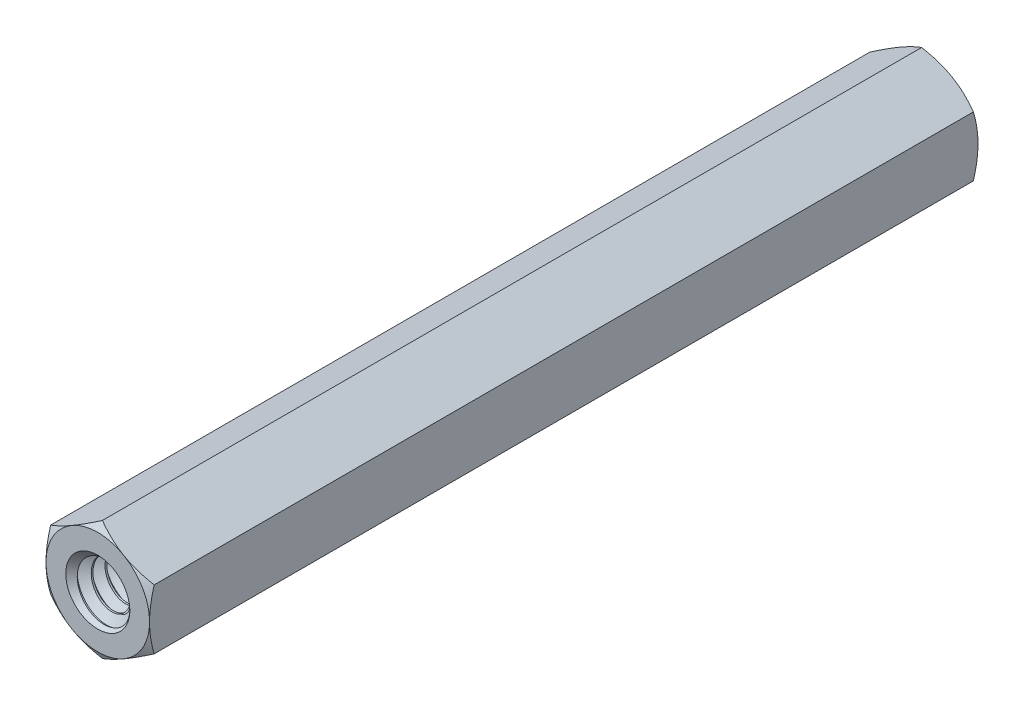
from build123d import *

# Parameters (mm, degrees)
EXTRUDE1_DEPTH          = 19.05
EXTRUDE1_DEPTH_BACK     = 19.05
SKETCH1_R               = 1.4224
SWEEP1_PITCH            = 0.635
EXTRUDE2_DEPTH          = 39.905584076
SKETCH8_OUTSIDE_W       = 152.882
SKETCH8_OUTSIDE_H       = 153.62
SKETCH8_OUTSIDE_R       = 2.38125
EXTRUDE4_DEPTH          = 39.905584076
EXTRUDE4_DRAFT          = -60
MIRROR1_COPY_1_SKETCH_W = 152.882
MIRROR1_COPY_1_SKETCH_H = 153.62
MIRROR1_COPY_1_SKETCH_R = 2.38125
MIRROR1_COPY_1_DEPTH    = 39.905584076
MIRROR1_COPY_1_DRAFT    = -60
SKETCH9_W               = 25.4
SKETCH9_H               = 1.4732


with BuildPart() as part:
    # Sketch1 → Extrude1 (new, two sides: drawn at the far end of the back side and taken through both)
    with BuildSketch(Plane.XY.offset(-EXTRUDE1_DEPTH_BACK)):
        Polygon((0, 2.749630657), (-2.38125, 1.374815329), (-2.38125, -1.374815329), (0, -2.749630657), (2.38125, -1.374815329), (2.38125, 1.374815329), align=None)
        with Locations(Location((0, 0, 0), (0, 0, 180))):
            Circle(SKETCH1_R, mode=Mode.SUBTRACT)
    extrude(amount=EXTRUDE1_DEPTH + EXTRUDE1_DEPTH_BACK)

    # Sweep1: the profile of Sketch12 profile screwed along a right-hand helix of 61 turns, 6 arcs to a turn; built about Z, then put on its axis
    sweep1_z = Axis((0, 0, 0), (0, 0, 1))
    sweep1_corners = [(1.4227, 0, -0.555798205), (1.4227, 0, 0.000173205), (1.009955401, 0, -0.238125), (1.009955401, 0, -0.3175)]
    with BuildLine(mode=Mode.PRIVATE) as sweep1_profile:
        Line(sweep1_corners[0], sweep1_corners[1])
        Line(sweep1_corners[1], sweep1_corners[2])
        Line(sweep1_corners[2], sweep1_corners[3])
        Line(sweep1_corners[3], sweep1_corners[0])
    sweep1_cap = Face(sweep1_profile.wire())
    sweep1_turn_angles = [0, 30, 60, 90, 120, 150, 180, 210, 240, 270, 300, 330, 360, 390, 420, 450, 480, 510, 540, 570, 600, 630, 660, 690, 720]
    sweep1_turn_weights = [1, 0.8660254037844387, 1, 0.8660254037844387, 1, 0.8660254037844387, 1, 0.8660254037844387, 1, 0.8660254037844387, 1, 0.8660254037844387, 1, 0.8660254037844387, 1, 0.8660254037844387, 1, 0.8660254037844387, 1, 0.8660254037844387, 1, 0.8660254037844387, 1, 0.8660254037844387, 1]
    sweep1_turn_rails = [Edge.make_bspline([Vector(p[0], p[1], 0).rotate(sweep1_z, sweep1_turn_angles[k]) / sweep1_turn_weights[k] + Vector(0, 0, p[2] + SWEEP1_PITCH * sweep1_turn_angles[k] / 360) for k in range(25)], [0, 0, 0, 1, 1, 2, 2, 3, 3, 4, 4, 5, 5, 6, 6, 7, 7, 8, 8, 9, 9, 10, 10, 11, 11, 12, 12, 12], 2, sweep1_turn_weights) for p in sweep1_corners]
    sweep1_turn_sides = [Face.make_surface_from_curves(sweep1_turn_rails[p[0]], sweep1_turn_rails[p[1]]) for p in [(0, 1), (1, 2), (2, 3), (3, 0)]]
    sweep1_last_angles = [21600, 21630, 21660, 21690, 21720, 21750, 21780, 21810, 21840, 21870, 21900, 21930, 21960]
    sweep1_last_weights = [1, 0.8660254037844387, 1, 0.8660254037844387, 1, 0.8660254037844387, 1, 0.8660254037844387, 1, 0.8660254037844387, 1, 0.8660254037853276, 1]
    sweep1_last_rails = [Edge.make_bspline([Vector(p[0], p[1], 0).rotate(sweep1_z, sweep1_last_angles[k]) / sweep1_last_weights[k] + Vector(0, 0, p[2] + SWEEP1_PITCH * sweep1_last_angles[k] / 360) for k in range(13)], [0, 0, 0, 1, 1, 2, 2, 3, 3, 4, 4, 5, 5, 6, 6, 6], 2, sweep1_last_weights) for p in sweep1_corners]
    sweep1_last_sides = [Face.make_surface_from_curves(sweep1_last_rails[p[0]], sweep1_last_rails[p[1]]) for p in [(0, 1), (1, 2), (2, 3), (3, 0)]]
    sweep1 = Plane(origin=(0, 0, -19.05), x_dir=(0, 1, 0), z_dir=(0, 0, 1)) * Solid(Shell([*[p.moved(Location((0, 0, 2 * SWEEP1_PITCH * i))) for i in range(30) for p in sweep1_turn_sides], *sweep1_last_sides, sweep1_cap, sweep1_cap.rotate(sweep1_z, 21960).moved(Location((0, 0, SWEEP1_PITCH * 21960 / 360)))]))
    add(sweep1)

    # Sketch6 → Extrude2 (cut, through all)
    with BuildSketch(Plane(origin=(0, 0, -19.05), x_dir=(-1, 0, 0), z_dir=(0, 0, -1))):
        Polygon((0, 2.749630657), (-2.38125, 1.374815329), (-2.38125, -1.374815329), (0, -2.749630657), (2.38125, -1.374815329), (2.38125, 1.374815329), align=None)
    extrude2 = extrude(amount=EXTRUDE2_DEPTH, mode=Mode.SUBTRACT)

    # Extrude3 cone 1 section (through the dimple's axis) → Extrude3 (revolve, cut)
    with BuildSketch(Plane(origin=(0, 0, -19.05), x_dir=(0, 1, 0), z_dir=(1, 0, 0))):
        Polygon((0, 0), (1.4732, 0), (0, 1.579813584), align=None)
    extrude3 = revolve(axis=Axis((0, 0, -19.05), (0, 0, 1)), mode=Mode.SUBTRACT)


with BuildPart() as extrude4_tool:
    # Sketch8 outside → Extrude4 (with draft: the straight prism first)
    with BuildSketch(Plane(origin=(0, 0, -19.05), x_dir=(-1, 0, 0), z_dir=(0, 0, -1))):
        Rectangle(SKETCH8_OUTSIDE_W, SKETCH8_OUTSIDE_H)
        Circle(SKETCH8_OUTSIDE_R, mode=Mode.SUBTRACT)
    extrude(amount=-EXTRUDE4_DEPTH)
    # Extrude4: the draft: its side faces are tilted about the plane it starts from
    extrude4_sides = [extrude4_tool.faces().sort_by_distance(p)[0] for p in [
        (0, -76.81, 0.902792038),
        (-76.441, 0, 0.902792038),
        (0, 76.81, 0.902792038),
        (76.441, 0, 0.902792038),
        (2.38125, 0, 0.902792038),
    ]]
    draft(extrude4_sides, Plane(origin=(0, 0, -19.05), x_dir=(-1, 0, 0), z_dir=(0, 0, -1)), EXTRUDE4_DRAFT)


with BuildPart() as part_1:
    add(part.part)

    # Extrude4: cut by extrude4_tool
    add(extrude4_tool.part, mode=Mode.SUBTRACT)

    # Mirror1: Extrude2, Extrude3 across plane
    add(extrude2.mirror(Plane.XY), mode=Mode.SUBTRACT)
    add(extrude3.mirror(Plane.XY), mode=Mode.SUBTRACT)


with BuildPart() as mirror1_copy_1_tool:
    # Mirror1 copy 1 sketch → Mirror1 copy 1 (with draft: the straight prism first)
    with BuildSketch(Plane(origin=(0, 0, 19.05), x_dir=(-1, 0, 0), z_dir=(0, 0, 1))):
        Rectangle(MIRROR1_COPY_1_SKETCH_W, MIRROR1_COPY_1_SKETCH_H)
        Circle(MIRROR1_COPY_1_SKETCH_R, mode=Mode.SUBTRACT)
    extrude(amount=-MIRROR1_COPY_1_DEPTH)
    # Mirror1 copy 1: the draft: its side faces are tilted about the plane it starts from
    mirror1_copy_1_sides = [mirror1_copy_1_tool.faces().sort_by_distance(p)[0] for p in [
        (0, -76.81, -0.902792038),
        (-76.441, 0, -0.902792038),
        (0, 76.81, -0.902792038),
        (76.441, 0, -0.902792038),
        (2.38125, 0, -0.902792038),
    ]]
    draft(mirror1_copy_1_sides, Plane(origin=(0, 0, 19.05), x_dir=(-1, 0, 0), z_dir=(0, 0, 1)), MIRROR1_COPY_1_DRAFT)


with BuildPart() as part_2:
    add(part_1.part)

    # Mirror1 copy 1: cut by mirror1_copy_1_tool
    add(mirror1_copy_1_tool.part, mode=Mode.SUBTRACT)

    # Sketch9 → Revolve 2 (revolve)
    with BuildSketch(Plane(origin=(0, 0, 0), x_dir=(0, 0, -1), z_dir=(1, 0, 0)), mode=Mode.PRIVATE) as revolve_2_sk:
        with Locations((0, 0.7366)):
            Rectangle(SKETCH9_W, SKETCH9_H)
    revolve(revolve_2_sk.sketch.rotate(Axis((0, 0, 19.05), (0, 0, -1)), 270), axis=Axis((0, 0, 19.05), (0, 0, -1)))


solid = part_2.part
